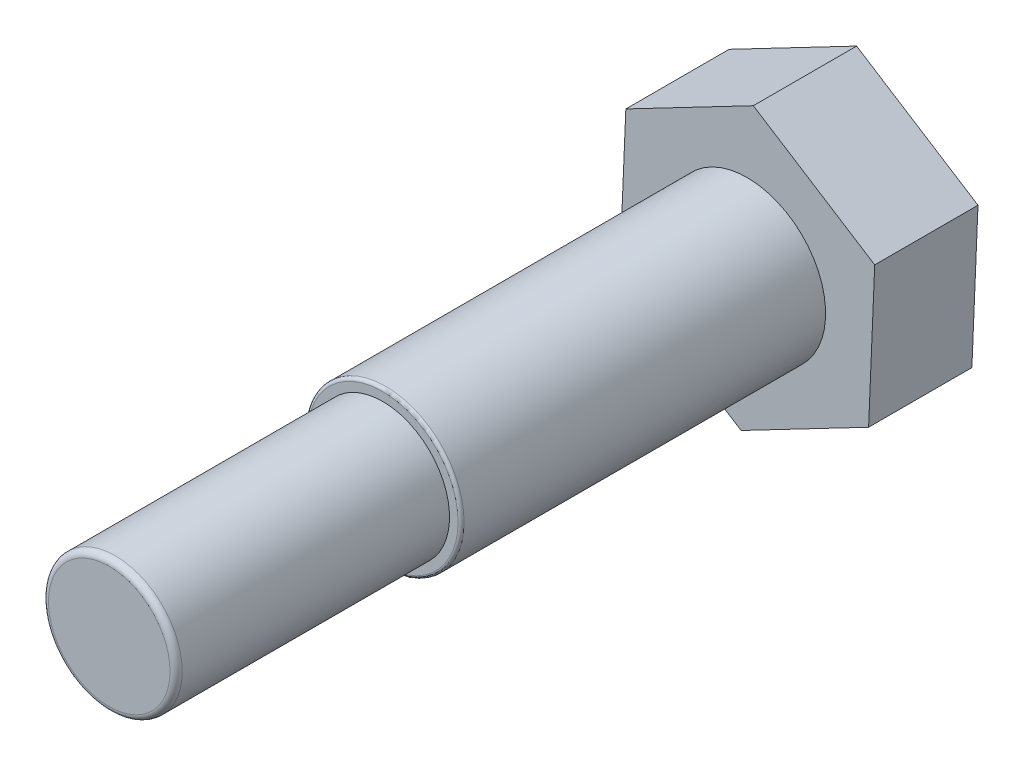
from build123d import *

# Parameters (mm, degrees)
EXTRUDE_305_DEPTH = 17
SKETCH_2_R        = 12.9
EXTRUDE_1_DEPTH   = 60
SKETCH_3_R        = 11
EXTRUDE_2_DEPTH   = 45
FILLET_2_R        = 1
FILLET_4_R        = 0.5


with BuildPart() as part:
    # 草图1 → Extrude 305 (new body)
    with BuildSketch(Plane.XY):
        Polygon((20.984201837, 10.954296262), (1.005402075, 23.65), (-19.978799762, 12.695703738), (-20.984201837, -10.954296262), (-1.005402075, -23.65), (19.978799762, -12.695703738), align=None)
    extrude(amount=EXTRUDE_305_DEPTH)

    # 草图2 → 凸台-拉伸1 (add)
    with BuildSketch(Plane.XY.offset(17)):
        Circle(SKETCH_2_R)
    extrude(amount=EXTRUDE_1_DEPTH)

    # 草图3 → 凸台-拉伸2 (add)
    with BuildSketch(Plane.XY.offset(77)):
        Circle(SKETCH_3_R)
    extrude(amount=EXTRUDE_2_DEPTH)

    # 圆角2
    fillet_2_edges = [part.edges().sort_by_distance(p)[0] for p in [
        (-11, 0, 122),
    ]]
    fillet(fillet_2_edges, radius=FILLET_2_R)

    # 圆角4
    fillet_4_edges = [part.edges().sort_by_distance(p)[0] for p in [
        (-12.9, 0, 77),
    ]]
    fillet(fillet_4_edges, radius=FILLET_4_R)


solid = part.part
